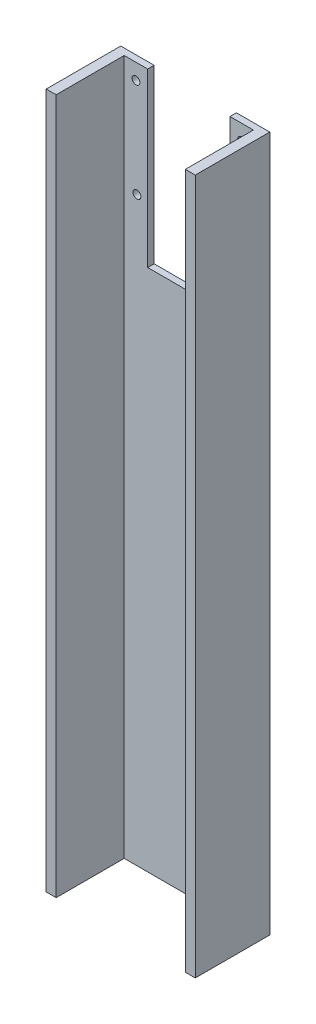
from build123d import *

# Parameters (mm, degrees)
BOSS_EXTRUDE1_DEPTH = 177.8
SKETCH2_R           = 2
SKETCH2_W           = 21.020738686
SKETCH2_H           = 87.907641246
CUT_EXTRUDE1_DEPTH  = 186.13603324


with BuildPart() as part:
    # Sketch1 → Boss-Extrude1 (new, symmetric)
    with BuildSketch(Plane(origin=(0, 0, 0), x_dir=(1, 0, 0), z_dir=(0, 1, 0))):
        Polygon((-38.1, -19.05), (-33.02, -19.05), (-33.02, 15.748), (33.02, 15.748), (33.02, -19.05), (38.1, -19.05), (38.1, 19.05), (-38.1, 19.05), align=None)
    extrude(amount=BOSS_EXTRUDE1_DEPTH, both=True)

    # Sketch2 → Cut-Extrude1 (cut, through all)
    with BuildSketch(Plane.XY.offset(-15.748)):
        with Locations((-27.020369343, 169.8)):
            Circle(SKETCH2_R)
        with Locations((-26.52, 119.475689004)):
            Circle(SKETCH2_R)
        with Locations((-10.510369343, 133.846179377)):
            Rectangle(SKETCH2_W, SKETCH2_H)
    cut_extrude1 = extrude(amount=-CUT_EXTRUDE1_DEPTH, mode=Mode.SUBTRACT)

    # Mirror1: Cut-Extrude1 across plane
    add(cut_extrude1.mirror(Plane(origin=(0, 0, 0), x_dir=(0, 0, 1), z_dir=(1, 0, 0))), mode=Mode.SUBTRACT)


solid = part.part
